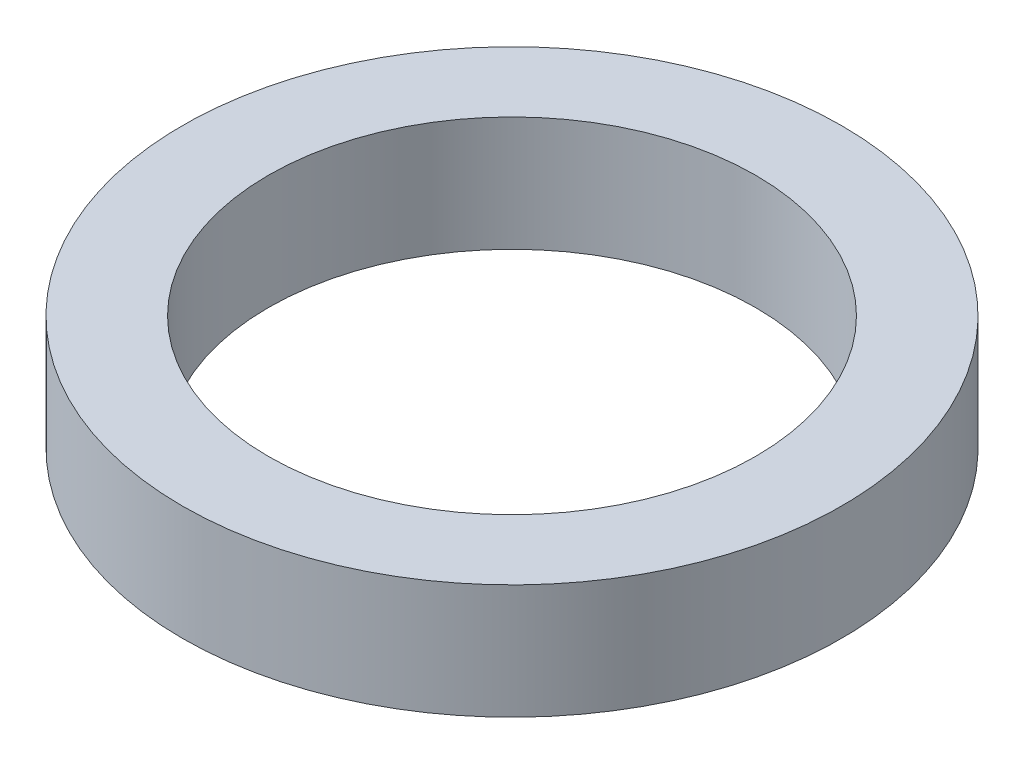
from build123d import *

# Parameters (mm, degrees)
SKETCH1_R           = 57.5
BOSS_EXTRUDE1_DEPTH = 20
SKETCH2_R           = 42.5
CUT_EXTRUDE1_DEPTH  = 84.740671122


with BuildPart() as part:
    # Sketch1 → Boss-Extrude1 (new body)
    with BuildSketch(Plane(origin=(0, 0, 0), x_dir=(1, 0, 0), z_dir=(0, 1, 0))):
        Circle(SKETCH1_R)
    extrude(amount=BOSS_EXTRUDE1_DEPTH)

    # Sketch2 → Cut-Extrude1 (cut, through all)
    with BuildSketch(Plane(origin=(0, 0, 0), x_dir=(1, 0, 0), z_dir=(0, 1, 0))):
        Circle(SKETCH2_R)
    extrude(amount=CUT_EXTRUDE1_DEPTH, mode=Mode.SUBTRACT)


solid = part.part
